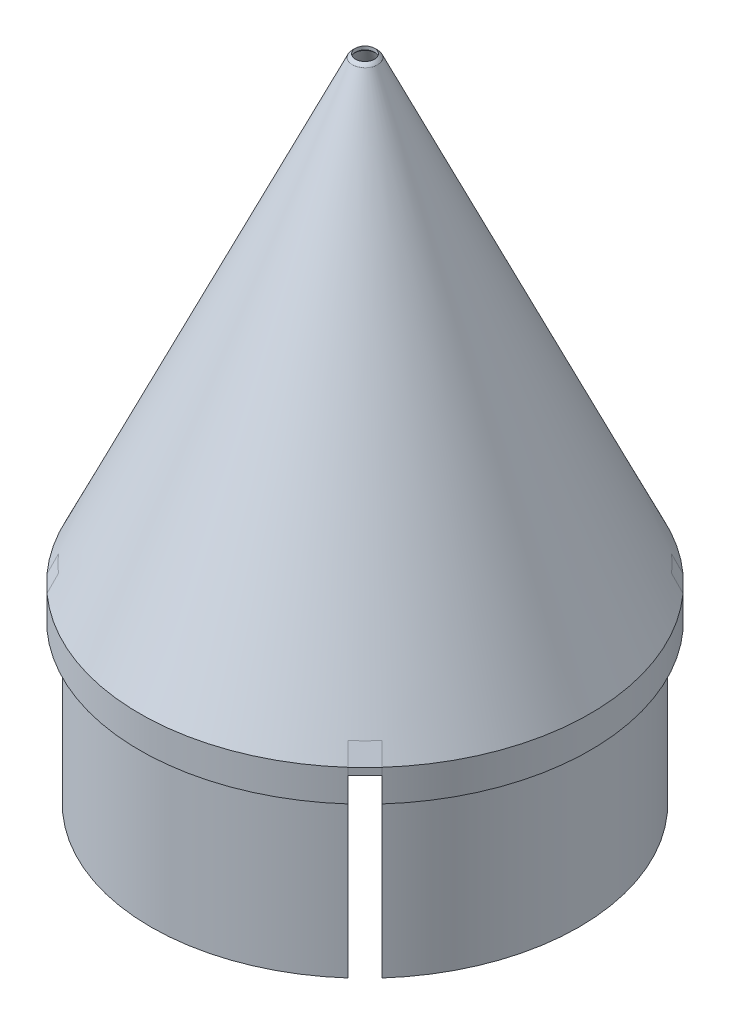
from build123d import *

# Parameters (mm, degrees)
SHELL1_T            = -0.8
SKETCH7_R           = 3
CUT_EXTRUDE3_DEPTH  = 186.253539274
BOSS_EXTRUDE1_DEPTH = 7.5
CUT_EXTRUDE4_DEPTH  = 1.75
CIRPATTERN1_COUNT   = 2
BOSS_EXTRUDE3_DEPTH = 10
CUT_EXTRUDE8_DEPTH  = 65.5
SKETCH17_R          = 0.75
BOSS_EXTRUDE4_DEPTH = 1.25
BOSS_EXTRUDE7_START = -6.25
BOSS_EXTRUDE7_DEPTH = 6.25
CUT_EXTRUDE9_REACH  = 192.044
SKETCH21_R          = 2.8
SKETCH22_R          = 4.75
SKETCH22_R_2        = 2.8
BOSS_EXTRUDE8_DEPTH = 4
SKETCH23_R          = 4.75
SKETCH23_R_2        = 2.3
BOSS_EXTRUDE9_DEPTH = 2
CIRPATTERN4_COUNT   = 4
BOSS_EXTRUDE6_REACH = 190.07
CIRPATTERN8_COUNT   = 4


with BuildPart() as part:
    # Sketch3 → Revolve1 (revolve)
    with BuildSketch(Plane.XY):
        with BuildLine():
            Line((0, 0), (0, 155.681963674))
            ThreePointArc((0, 155.681963674), (2.236067977, 155.154099629), (4, 153.681963674))
            Line((4, 153.681963674), (71, 10))
            Line((71, 10), (71, 0))
            Line((71, 0), (67.5, 0))
            Line((67.5, 0), (67.5, -50))
            Line((67.5, -50), (0, -50))
            Line((0, -50), (0, 0))
        make_face()
    revolve(axis=Axis((0, 0, 0), (0, 1, 0)))

    # Shell1
    shell1_openings = [part.faces().sort_by_distance(p)[0] for p in [
        (0, -50, 0),
    ]]
    offset(amount=SHELL1_T, openings=shell1_openings, kind=Kind.INTERSECTION)

    # Sketch7 → Cut-Extrude3 (cut, through all)
    with BuildSketch(Plane(origin=(0, 0, 0), x_dir=(1, 0, 0), z_dir=(0, 1, 0))):
        Circle(SKETCH7_R)
    extrude(amount=CUT_EXTRUDE3_DEPTH, mode=Mode.SUBTRACT)

    # Sketch8 → Boss-Extrude1 (add, symmetric)
    with BuildSketch(Plane(origin=(0, 0, 0), x_dir=(0, 0, -1), z_dir=(1, 0, 0))):
        Polygon((-39.806982196, 40.909925586), (-39.806982196, 35.909925586), (-44.806982196, 34.090074414), (-58.88391148, 34.090074414), (-44.806982196, 64.278146683), (-44.806982196, 44.090074414), (-44.806982196, 39.090074414), align=None)
    boss_extrude1 = extrude(amount=BOSS_EXTRUDE1_DEPTH, both=True)

    # Sketch9 → Cut-Extrude4 (cut, symmetric)
    with BuildSketch(Plane(origin=(0, 0, 0), x_dir=(0, 0, -1), z_dir=(1, 0, 0))):
        Polygon((-44.806982196, 39.090074414), (-44.806982196, 62.941354839), (-58.88391148, 34.090074414), (-44.806982196, 34.090074414), (-39.806982196, 35.909925586), (-39.806982196, 40.909925586), align=None)
    cut_extrude4 = extrude(amount=CUT_EXTRUDE4_DEPTH, both=True, mode=Mode.SUBTRACT)

    # CirPattern1: Boss-Extrude1, Cut-Extrude4 ×2 about axis
    cirpattern1_axis = Axis((0, 0, 0), (0, -1, 0))
    add([boss_extrude1.rotate(cirpattern1_axis, i * 360 / CIRPATTERN1_COUNT) for i in range(1, CIRPATTERN1_COUNT)])
    add([cut_extrude4.rotate(cirpattern1_axis, i * 360 / CIRPATTERN1_COUNT) for i in range(1, CIRPATTERN1_COUNT)], mode=Mode.SUBTRACT)

    # Sketch11 → Boss-Extrude3 (add, symmetric)
    with BuildSketch(Plane(origin=(0, 0, 0), x_dir=(0, -1, 0), z_dir=(0.707106781186552, 0, 0.7071067811865431))):
        with BuildLine():
            Line((-15.360916844, 53.7), (-15.360916844, 67.386877254))
            Line((-15.360916844, 67.386877254), (-9.82264427, 70.2))
            Line((-9.82264427, 70.2), (-0.8, 70.2))
            Line((-0.8, 70.2), (-0.8, 66.7))
            Line((-0.8, 66.7), (-0.8, 53.7))
            ThreePointArc((-0.8, 53.7), (-8.080458422, 46.419541578), (-15.360916844, 53.7))
        make_face()
    boss_extrude3 = extrude(amount=BOSS_EXTRUDE3_DEPTH, both=True)

    # Sketch13 → Cut-Extrude8 (cut)
    with BuildSketch(Plane.XZ.offset(50)):
        with BuildLine():
            Line((30.1719222, -35.475223059), (35.475223059, -30.1719222))
            Line((35.475223059, -30.1719222), (52.786157009, -47.48285615))
            ThreePointArc((52.786157009, -47.48285615), (50.204581464, -50.204581464), (47.48285615, -52.786157009))
            Line((47.48285615, -52.786157009), (30.1719222, -35.475223059))
        make_face()
    cut_extrude8 = extrude(amount=-CUT_EXTRUDE8_DEPTH, mode=Mode.SUBTRACT)

    # Sketch15 → M4 Clearance Hole1 (revolve, cut)
    with BuildSketch(Plane(origin=(45.042701962, 8.080458422, -30.900566338), x_dir=(0.7071067811865432, 0, -0.7071067811865519), z_dir=(0, 1, 0))):
        Polygon((0, 0), (0, 21.442065486), (2.4, 20), (2.4, 0), align=None)
    m4_clearance_hole1 = revolve(axis=Axis((49.532830022, 8.080458422, -26.410438277), (-0.7071067811865519, 0, -0.7071067811865432)), mode=Mode.SUBTRACT)

    # Sketch17 → Boss-Extrude4 (add, symmetric)
    with BuildSketch(Plane(origin=(0, 0, 0), x_dir=(0, -1, 0), z_dir=(0.707106781186552, 0, 0.7071067811865431))):
        with BuildLine():
            Line((-64.990829629, 44.47465268), (-52.181285177, 50.447841356))
            Line((-52.181285177, 50.447841356), (-50.912564437, 47.72706095))
            ThreePointArc((-50.912564437, 47.72706095), (-50.972988012, 46.343133558), (-52.141292504, 45.59884151))
            Line((-52.141292504, 45.59884151), (-64.990829629, 44.47465268))
        make_face()
        with Locations((-52.272026118, 47.093133558)):
            Circle(SKETCH17_R, mode=Mode.SUBTRACT)
    boss_extrude4 = extrude(amount=BOSS_EXTRUDE4_DEPTH, both=True)

    # Sketch19 → Boss-Extrude7 (add)
    with BuildSketch(Plane(origin=(-7.071067812, 0, -7.071067812), x_dir=(-0.7071067811865432, 0, 0.7071067811865519), z_dir=(-0.7071067811865519, 0, -0.7071067811865432)).offset(BOSS_EXTRUDE7_START)):
        with BuildLine():
            Line((-44.7, 12.830458422), (-48.182520971, 12.830458422))
            ThreePointArc((-48.182520971, 12.830458422), (-46.419541578, 8.080458422), (-48.182520971, 3.330458422))
            Line((-48.182520971, 3.330458422), (-44.7, 3.330458422))
            ThreePointArc((-44.7, 3.330458422), (-39.95, 8.080458422), (-44.7, 12.830458422))
        make_face()
    boss_extrude7 = extrude(amount=BOSS_EXTRUDE7_DEPTH)

    # Sketch21 → Cut-Extrude9 (cut, up to next)
    with BuildSketch(Plane(origin=(-7.071067812, 0, -7.071067812), x_dir=(-0.7071067811865432, 0, 0.7071067811865519), z_dir=(-0.7071067811865519, 0, -0.7071067811865432)), mode=Mode.PRIVATE) as cut_extrude9_sk1:
        with Locations((-44.7, 8.080458422)):
            Circle(SKETCH21_R)
    cut_extrude9_tool1 = extrude(cut_extrude9_sk1.sketch, amount=-CUT_EXTRUDE9_REACH, mode=Mode.PRIVATE) & part.part
    cut_extrude9 = cut_extrude9_tool1.solids().sort_by_distance((24.536605, 8.080458, -38.678741))[0]
    add(cut_extrude9, mode=Mode.SUBTRACT)

    # Sketch22 → Boss-Extrude8 (add)
    with BuildSketch(Plane(origin=(-7.071067812, 0, -7.071067812), x_dir=(-0.7071067811865432, 0, 0.7071067811865519), z_dir=(-0.7071067811865519, 0, -0.7071067811865432))):
        with Locations((-44.7, 8.080458422)):
            Circle(SKETCH22_R)
        with Locations((-44.7, 8.080458422)):
            Circle(SKETCH22_R_2, mode=Mode.SUBTRACT)
    boss_extrude8 = extrude(amount=BOSS_EXTRUDE8_DEPTH)

    # Sketch23 → Boss-Extrude9 (add)
    with BuildSketch(Plane(origin=(-9.899494937, 0, -9.899494937), x_dir=(-0.7071067811865434, 0, 0.7071067811865517), z_dir=(-0.7071067811865517, 0, -0.7071067811865434))):
        with Locations((-44.7, 8.080458422)):
            Circle(SKETCH23_R)
        with Locations((-44.7, 8.080458422)):
            Circle(SKETCH23_R_2, mode=Mode.SUBTRACT)
    boss_extrude9 = extrude(amount=BOSS_EXTRUDE9_DEPTH)

    # CirPattern4: Boss-Extrude3, Cut-Extrude8, M4 Clearance Hole1, Boss-Extrude4, Boss-Extrude7, Cut-Extrude9, Boss-Extrude8, Boss-Extrude9 ×4 about axis
    cirpattern4_axis = Axis((0, 0, 0), (0, -1, 0))
    add([boss_extrude3.rotate(cirpattern4_axis, i * 360 / CIRPATTERN4_COUNT) for i in range(1, CIRPATTERN4_COUNT)])
    add([cut_extrude8.rotate(cirpattern4_axis, i * 360 / CIRPATTERN4_COUNT) for i in range(1, CIRPATTERN4_COUNT)], mode=Mode.SUBTRACT)
    add([m4_clearance_hole1.rotate(cirpattern4_axis, i * 360 / CIRPATTERN4_COUNT) for i in range(1, CIRPATTERN4_COUNT)], mode=Mode.SUBTRACT)
    add([boss_extrude4.rotate(cirpattern4_axis, i * 360 / CIRPATTERN4_COUNT) for i in range(1, CIRPATTERN4_COUNT)])
    add([boss_extrude7.rotate(cirpattern4_axis, i * 360 / CIRPATTERN4_COUNT) for i in range(1, CIRPATTERN4_COUNT)])
    add([cut_extrude9.rotate(cirpattern4_axis, i * 360 / CIRPATTERN4_COUNT) for i in range(1, CIRPATTERN4_COUNT)], mode=Mode.SUBTRACT)
    add([boss_extrude8.rotate(cirpattern4_axis, i * 360 / CIRPATTERN4_COUNT) for i in range(1, CIRPATTERN4_COUNT)])
    add([boss_extrude9.rotate(cirpattern4_axis, i * 360 / CIRPATTERN4_COUNT) for i in range(1, CIRPATTERN4_COUNT)])

    # Sketch18 → Boss-Extrude6 (add, up to next)
    with BuildSketch(Plane(origin=(1.944543648, 0, -7.247844507), x_dir=(0.7071067811865437, 0, -0.7071067811865513), z_dir=(0.7071067811865513, 0, 0.7071067811865437)), mode=Mode.PRIVATE) as boss_extrude6_sk1:
        with BuildLine():
            Line((61.832487622, 15.5), (64.400899148, 10))
            Line((64.400899148, 10), (64.400899148, 7.805634816))
            Line((64.400899148, 7.805634816), (62.58432966, 9.97053803))
            ThreePointArc((62.58432966, 9.97053803), (62.166779573, 12.853725749), (60.948439685, 15.5))
            Line((60.948439685, 15.5), (61.832487622, 15.5))
        make_face()
    boss_extrude6_tool1 = extrude(boss_extrude6_sk1.sketch, amount=BOSS_EXTRUDE6_REACH, mode=Mode.PRIVATE) - part.part
    boss_extrude6 = boss_extrude6_tool1.solids().sort_by_distance((46.496587, 11.546485, -51.799888))[0]
    add(boss_extrude6)

    # CirPattern8: Boss-Extrude6 ×4 about axis
    cirpattern8_axis = Axis((0, 0, 0), (0, -1, 0))
    for i in range(1, CIRPATTERN8_COUNT):
        add(boss_extrude6.rotate(cirpattern8_axis, i * 360 / CIRPATTERN8_COUNT))


solid = part.part
